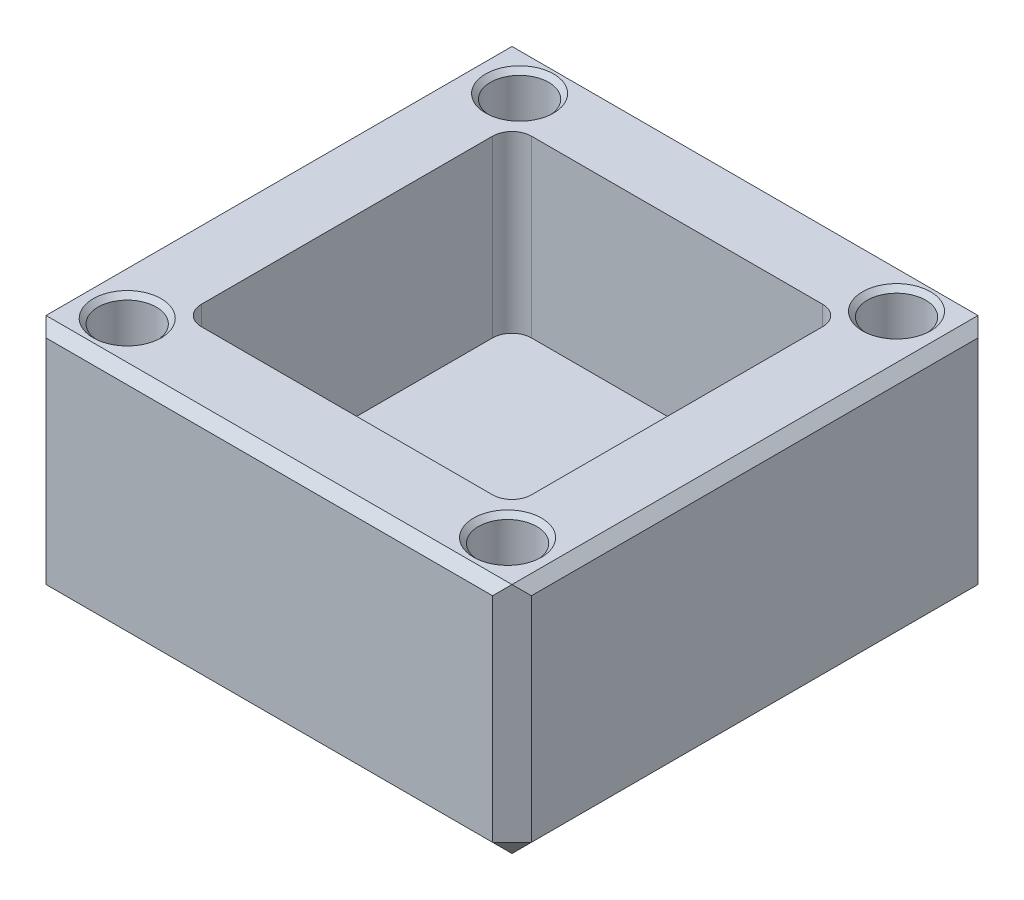
from build123d import *

# Parameters (mm, degrees)
SKETCH1_W           = 50
SKETCH1_H           = 50
BOSS_EXTRUDE1_DEPTH = 25
SKETCH2_R           = 3
SKETCH2_W           = 34
SKETCH2_H           = 34
CUT_EXTRUDE1_DEPTH  = 18
CHAMFER1_SIZE       = 2
CHAMFER2_SIZE       = 1
FILLET1_R           = 2
CHAMFER3_SIZE       = 0.5


with BuildPart() as part:
    # Sketch1 → Boss-Extrude1 (new body)
    with BuildSketch(Plane(origin=(0, 0, 0), x_dir=(1, 0, 0), z_dir=(0, 1, 0))):
        Rectangle(SKETCH1_W, SKETCH1_H)
    extrude(amount=BOSS_EXTRUDE1_DEPTH)

    # Sketch2 → Cut-Extrude1 (cut)
    with BuildSketch(Plane(origin=(0, 25, 0), x_dir=(1, 0, 0), z_dir=(0, 1, 0))):
        with Locations(Location((-19.568429399, -20.066458938, 0), (0, 0, 270))):
            Circle(SKETCH2_R)
        with Locations(Location((-19.410173636, 20.192344443, 0), (0, 0, 270))):
            Circle(SKETCH2_R)
        with Locations(Location((19.591857754, -20.046682357, 0), (0, 0, 270))):
            Circle(SKETCH2_R)
        with Locations(Location((19.434027978, 20.17419404, 0), (0, 0, 270))):
            Circle(SKETCH2_R)
        Rectangle(SKETCH2_W, SKETCH2_H)
    extrude(amount=-CUT_EXTRUDE1_DEPTH, mode=Mode.SUBTRACT)

    # Chamfer1
    chamfer1_edges = [part.edges().sort_by_distance(p)[0] for p in [
        (0, 0, 25),
        (-25, 0, 0),
        (0, 0, -25),
        (25, 0, 0),
        (25, 12.5, 25),
        (-25, 12.5, 25),
        (-25, 12.5, -25),
        (25, 12.5, -25),
    ]]
    chamfer(chamfer1_edges, length=CHAMFER1_SIZE)

    # Chamfer2
    chamfer2_edges = [part.edges().sort_by_distance(p)[0] for p in [
        (-25, 25, 0),
        (0, 25, -25),
        (0, 25, 25),
        (25, 25, 0),
    ]]
    chamfer(chamfer2_edges, length=CHAMFER2_SIZE - 0.0001)  # a hair under: the kernel refuses the full size

    # Fillet1
    fillet1_edges = [part.edges().sort_by_distance(p)[0] for p in [
        (17, 16, 17),
        (-17, 16, 17),
        (-17, 16, -17),
        (17, 16, -17),
    ]]
    fillet(fillet1_edges, radius=FILLET1_R)

    # Chamfer3
    chamfer3_edges = [part.edges().sort_by_distance(p)[0] for p in [
        (19.591857754, 25, 17.046682357),
        (19.434027978, 25, -23.17419404),
        (-19.410173636, 25, -23.192344443),
        (-19.568429399, 25, 17.066458938),
    ]]
    chamfer(chamfer3_edges, length=CHAMFER3_SIZE)


solid = part.part
